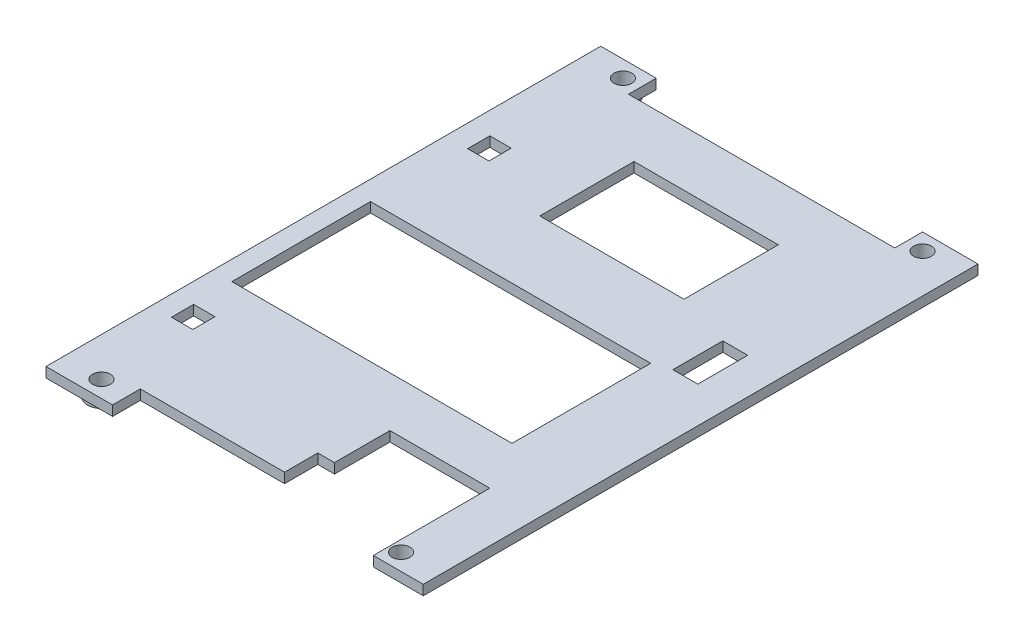
from build123d import *

# Parameters (mm, degrees)
SKETCH_1_W          = 68
SKETCH_1_H          = 100
EXTRUDE_1_DEPTH     = 1.8
SKETCH_2_W          = 48
SKETCH_2_H          = 5
SKETCH_2_W_2        = 26
SKETCH_2_H_2        = 17
SKETCH_2_W_3        = 3.846350714
SKETCH_2_H_3        = 4
SKETCH_2_W_4        = 50.5
SKETCH_2_H_4        = 25
SKETCH_2_W_5        = 24
SKETCH_2_W_6        = 18
SKETCH_2_H_5        = 16.79174546
SKETCH_2_W_7        = 4.5
SKETCH_2_H_6        = 9
CUT_EXTRUDE_1_DEPTH = 1.8
SKETCH_4_R          = 2.5
SKETCH_4_R_2        = 1.4
SKETCH_4_R_3        = 2
EXTRUDE_3_DEPTH     = 1
CUT_EXTRUDE_START   = -14
SKETCH_6_R          = 1.4
CUT_EXTRUDE_3_DEPTH = 14
SKETCH_8_W          = 5
SKETCH_8_H          = 5
SKETCH_8_W_2        = 18
SKETCH_8_H_2        = 4.20825454
CUT_EXTRUDE_4_DEPTH = 10
SKETCH_9_R          = 1.6
CUT_EXTRUDE_5_DEPTH = 10
SKETCH_10_W         = 3
SKETCH_10_H         = 6
CUT_EXTRUDE_6_DEPTH = 10


with BuildPart() as part:
    # 草图1 → 凸台-拉伸1 (new body)
    with BuildSketch(Plane(origin=(0, 0, 0), x_dir=(1, 0, 0), z_dir=(0, 1, 0))):
        with Locations((34, -50)):
            Rectangle(SKETCH_1_W, SKETCH_1_H)
    extrude(amount=EXTRUDE_1_DEPTH)

    # 草图2 → 切除-拉伸1 (cut)
    with BuildSketch(Plane(origin=(0, 1.8, 0), x_dir=(1, 0, 0), z_dir=(0, 1, 0))):
        with Locations((34, -2.5)):
            Rectangle(SKETCH_2_W, SKETCH_2_H)
        with Locations((34, -23.5)):
            Rectangle(SKETCH_2_W_2, SKETCH_2_H_2)
        with Locations((5.923175357, -26)):
            Rectangle(SKETCH_2_W_3, SKETCH_2_H_3)
        with Locations((5.535050967, -79)):
            Rectangle(SKETCH_2_W_3, SKETCH_2_H_3)
        with Locations((28.75, -57.5)):
            Rectangle(SKETCH_2_W_4, SKETCH_2_H_4)
        with Locations((24, -97.5)):
            Rectangle(SKETCH_2_W_5, SKETCH_2_H)
        with Locations((50, -91.60412727)):
            Rectangle(SKETCH_2_W_6, SKETCH_2_H_5)
        with Locations((59.25, -39.5)):
            Rectangle(SKETCH_2_W_7, SKETCH_2_H_6)
    extrude(amount=-CUT_EXTRUDE_1_DEPTH, mode=Mode.SUBTRACT)

    # 草图4 → 凸台-拉伸3 (add)
    # profile 1 of 4: a face of its own
    with BuildSketch(Plane.XZ):
        with Locations((7, 97)):
            Circle(SKETCH_4_R)
        with Locations((7, 97)):
            Circle(SKETCH_4_R_2, mode=Mode.SUBTRACT)
    # profile 2 of 4: a face of its own
    with BuildSketch(Plane.XZ):
        with Locations((61, 97)):
            Circle(SKETCH_4_R_3)
        with Locations((61, 97)):
            Circle(SKETCH_4_R_2, mode=Mode.SUBTRACT)
    # profile 3 of 4: a face of its own
    with BuildSketch(Plane.XZ):
        with Locations((61, 3)):
            Circle(SKETCH_4_R)
        with Locations((61, 3)):
            Circle(SKETCH_4_R_2, mode=Mode.SUBTRACT)
    # profile 4 of 4: a face of its own
    with BuildSketch(Plane.XZ):
        with Locations((7, 3)):
            Circle(SKETCH_4_R)
        with Locations((7, 3)):
            Circle(SKETCH_4_R_2, mode=Mode.SUBTRACT)
    extrude(amount=EXTRUDE_3_DEPTH)

    # 草图6 → 切除-拉伸3 (cut)
    with BuildSketch(Plane.XZ.offset(CUT_EXTRUDE_START)):
        with Locations((7, 97)):
            Circle(SKETCH_6_R)
        with Locations((61, 97)):
            Circle(SKETCH_6_R)
        with Locations((61, 3)):
            Circle(SKETCH_6_R)
        with Locations((7, 3)):
            Circle(SKETCH_6_R)
    extrude(amount=CUT_EXTRUDE_3_DEPTH, mode=Mode.SUBTRACT)

    # 草图8 → 切除-拉伸4 (cut)
    with BuildSketch(Plane(origin=(0, 1.8, 0), x_dir=(1, 0, 0), z_dir=(0, 1, 0))):
        with Locations((38.5, -97.5)):
            Rectangle(SKETCH_8_W, SKETCH_8_H)
        with Locations((50, -81.10412727)):
            Rectangle(SKETCH_8_W_2, SKETCH_8_H_2)
    extrude(amount=-CUT_EXTRUDE_4_DEPTH, mode=Mode.SUBTRACT)

    # 草图9 → 切除-拉伸5 (cut)
    with BuildSketch(Plane(origin=(0, 1.8, 0), x_dir=(1, 0, 0), z_dir=(0, 1, 0))):
        with Locations((7, -3)):
            Circle(SKETCH_9_R)
        with Locations((61, -3)):
            Circle(SKETCH_9_R)
        with Locations((61, -97)):
            Circle(SKETCH_9_R)
        with Locations((7, -97)):
            Circle(SKETCH_9_R)
    extrude(amount=-CUT_EXTRUDE_5_DEPTH, mode=Mode.SUBTRACT)

    # 草图10 → 切除-拉伸6 (cut)
    with BuildSketch(Plane.XZ):
        with Locations((39.5, 92)):
            Rectangle(SKETCH_10_W, SKETCH_10_H)
    extrude(amount=-CUT_EXTRUDE_6_DEPTH, mode=Mode.SUBTRACT)


solid = part.part
